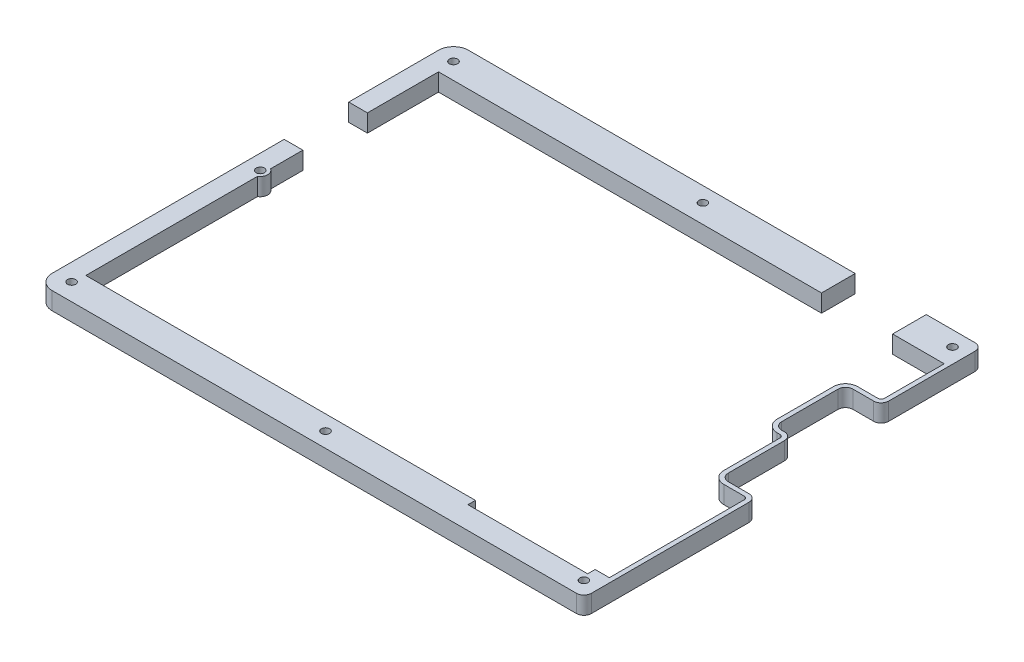
from build123d import *

# Parameters (mm, degrees)
SKETCH1_R             = 1.1
BOSS_EXTRUDE1_DEPTH   = 4.7
BOSS_EXTRUDE1_2_DEPTH = 4.7
BODY_MOVE_COPY2_ANGLE = 180


with BuildPart() as part:
    # Sketch1 → Boss-Extrude1 (new body)
    with BuildSketch(Plane(origin=(0, 0, 0), x_dir=(1, 0, 0), z_dir=(0, 1, 0))):
        with BuildLine():
            Line((52.294999703, -42.624999703), (52.294999703, -51.624999703))
            Line((52.294999703, -51.624999703), (65.295, -51.624999703))
            ThreePointArc((65.295, -51.624999703), (66.709213352, -51.039213352), (67.294999703, -49.625))
            Line((67.294999703, -49.625), (67.294999703, -26.574999406))
            ThreePointArc((67.294999703, -26.574999406), (66.709213266, -25.160785844), (65.294999703, -24.574999406))
            Line((65.294999703, -24.574999406), (59.764999703, -24.574999406))
            ThreePointArc((59.764999703, -24.574999406), (58.350786141, -23.989212969), (57.764999703, -22.574999406))
            Line((57.764999703, -22.574999406), (57.764999703, -7.524999406))
            ThreePointArc((57.764999703, -7.524999406), (58.350786141, -6.110785844), (59.764999703, -5.524999406))
            Line((59.764999703, -5.524999406), (60.524999703, -5.524999406))
            ThreePointArc((60.524999703, -5.524999406), (61.939213266, -4.939212969), (62.524999703, -3.524999406))
            Line((62.524999703, -3.524999406), (62.524999703, 11.525000594))
            ThreePointArc((62.524999703, 11.525000594), (63.110786141, 12.939214156), (64.524999703, 13.525000594))
            Line((64.524999703, 13.525000594), (70.044999703, 13.525000594))
            ThreePointArc((70.044999703, 13.525000594), (71.459213686, 14.110787205), (72.045000297, 15.525001188))
            Line((72.045000297, 15.525001188), (72.055000297, 57.625))
            ThreePointArc((72.055000297, 57.625), (71.469213859, 59.039213859), (70.055, 59.625000297))
            Line((70.055, 59.625000297), (-70.055, 59.625000297))
            ThreePointArc((-70.055, 59.625000297), (-72.883427125, 58.453427422), (-74.055, 55.625000297))
            Line((-74.055, 55.625000297), (-74.055, -6.374999703))
            Line((-74.055, -6.374999703), (-69.055, -6.374999703))
            Line((-69.055, -6.374999703), (-69.055, 2.275951502))
            ThreePointArc((-69.055, 2.275951502), (-68.057599513, 4.005), (-69.055, 5.734048498))
            Line((-69.055, 5.734048498), (-69.055, 51.625000297))
            Line((-69.055, 51.625000297), (35.053321378, 51.625000297))
            Line((35.053321378, 51.625000297), (35.053321378, 53.625000297))
            Line((35.053321378, 53.625000297), (67.053838122, 53.625000297))
            Line((67.053838122, 53.625000297), (67.053838122, 51.625000297))
            Line((67.053838122, 51.625000297), (70.845093609, 51.625000297))
            Line((70.845093609, 51.625000297), (70.845093609, 15.525001188))
            ThreePointArc((70.845093609, 15.525001188), (70.61075153, 14.959249361), (70.044999703, 14.724907282))
            Line((70.044999703, 14.724907282), (64.524999703, 14.724907282))
            ThreePointArc((64.524999703, 14.724907282), (62.262323985, 13.787676312), (61.325093015, 11.525000594))
            Line((61.325093015, 11.525000594), (61.325093015, -3.524999406))
            ThreePointArc((61.325093015, -3.524999406), (61.09075111, -4.090750813), (60.524999703, -4.325092718))
            Line((60.524999703, -4.325092718), (59.764999703, -4.325092718))
            ThreePointArc((59.764999703, -4.325092718), (57.502323985, -5.262323688), (56.565093015, -7.524999406))
            Line((56.565093015, -7.524999406), (56.565093015, -22.574999406))
            ThreePointArc((56.565093015, -22.574999406), (57.502323985, -24.837675124), (59.764999703, -25.774906094))
            Line((59.764999703, -25.774906094), (65.294999703, -25.775730637))
            ThreePointArc((65.294999703, -25.775730637), (65.86016807, -26.00983104), (66.094268472, -26.574999406))
            Line((66.094268472, -26.574999406), (66.094268472, -42.624999703))
            Line((66.094268472, -42.624999703), (52.294999703, -42.624999703))
        make_face()
        with Locations((63.295, -47.624999703)):
            Circle(SKETCH1_R, mode=Mode.SUBTRACT)
        with Locations((-69.455, 55.025)):
            Circle(SKETCH1_R, mode=Mode.SUBTRACT)
        with Locations((-1.001897871, 55.625000297)):
            Circle(SKETCH1_R, mode=Mode.SUBTRACT)
        with Locations((68.058102129, 55.625000297)):
            Circle(SKETCH1_R, mode=Mode.SUBTRACT)
        with Locations((-70.055, 4.005)):
            Circle(SKETCH1_R, mode=Mode.SUBTRACT)
    extrude(amount=BOSS_EXTRUDE1_DEPTH)


with BuildPart() as body_2:
    # Sketch1 → Boss-Extrude1 2 (new body)
    with BuildSketch(Plane(origin=(0, 0, 0), x_dir=(1, 0, 0), z_dir=(0, 1, 0))):
        with BuildLine():
            Line((-74.055, -23.624999703), (-69.055, -23.624999703))
            Line((-69.055, -23.624999703), (-69.055, -42.624999703))
            Line((-69.055, -42.624999703), (33.294999703, -42.624999703))
            Line((33.294999703, -42.624999703), (33.294999703, -51.624999703))
            Line((33.294999703, -51.624999703), (-70.055, -51.624999703))
            ThreePointArc((-70.055, -51.624999703), (-72.883427125, -50.453426828), (-74.055, -47.624999703))
            Line((-74.055, -47.624999703), (-74.055, -23.624999703))
        make_face()
        with Locations((-69.455, -47.025)):
            Circle(SKETCH1_R, mode=Mode.SUBTRACT)
        with Locations((-3.405, -47.624999703)):
            Circle(SKETCH1_R, mode=Mode.SUBTRACT)
    extrude(amount=BOSS_EXTRUDE1_2_DEPTH)


with BuildPart() as part_1:
    # Body-Move/Copy2: moved
    add(part.part.rotate(Axis((0, 2.35, -4.000000297), (1, 0, 0)), BODY_MOVE_COPY2_ANGLE))


with BuildPart() as body_2_1:
    # Body-Move/Copy2: moved
    add(body_2.part.rotate(Axis((0, 2.35, -4.000000297), (1, 0, 0)), BODY_MOVE_COPY2_ANGLE))


solid = Compound([part_1.part, body_2_1.part])
